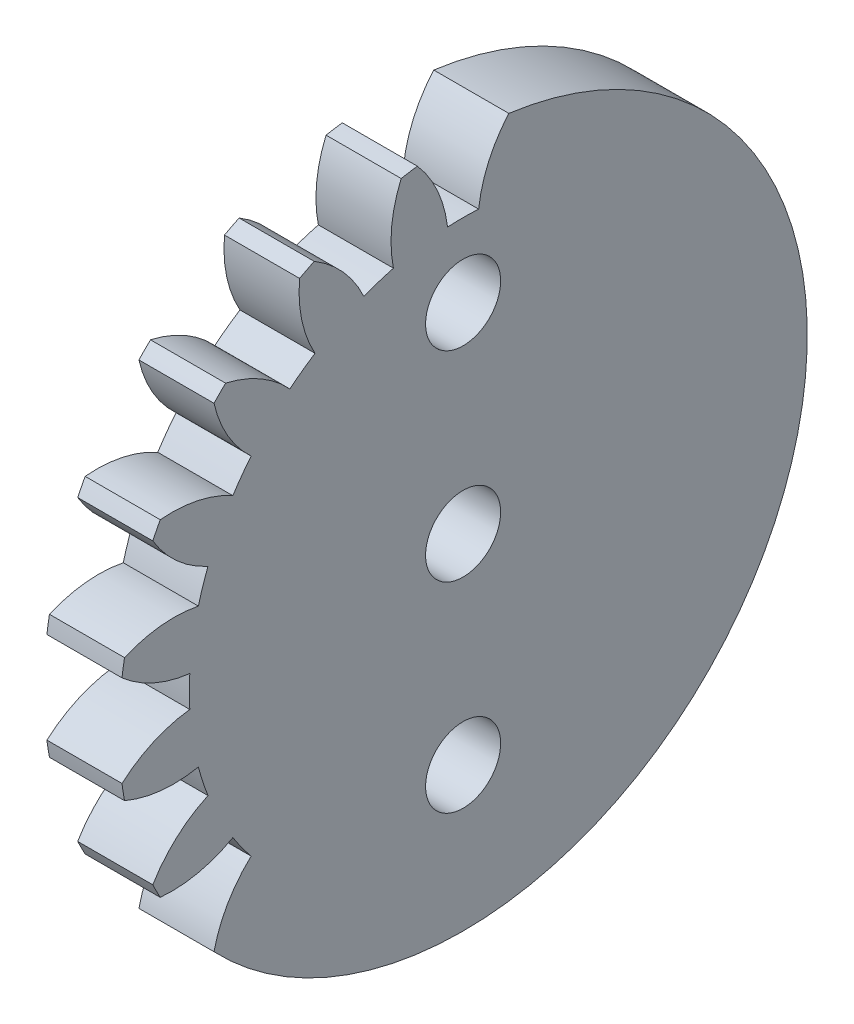
from build123d import *

# Parameters (mm, degrees)
BASPROSKE_W         = 3
BASPROSKE_H         = 13.75
TOOTHCUT_DEPTH      = 20.67549237
TEETHCUTS_COUNT     = 8
TEETHCUTS_ANGLE     = 126
BORSKE_R            = 1.5
BORE_DEPTH          = 50.0000508
SKETCH_2_R          = 1.5
CUT_EXTRUDE_2_DEPTH = 7


with BuildPart() as part:
    # BasProSke → Base-Revolve (revolve)
    with BuildSketch(Plane(origin=(0, 0, 0), x_dir=(1, 0, 0), z_dir=(0, 1, 0))):
        with Locations((1.5, 6.875)):
            Rectangle(BASPROSKE_W, BASPROSKE_H)
    revolve(axis=Axis((-10, 0, 0), (1, 0, 0)))

    # TooCutSke → ToothCut (cut, through all)
    with BuildSketch(Plane(origin=(0, 0, 0), x_dir=(0, 0, -1), z_dir=(1, 0, 0))):
        with BuildLine():
            ThreePointArc((0.62110296, 10.918848994), (0, 10.9365), (-0.62110296, 10.918848994))
            ThreePointArc((-0.62110296, 10.918848994), (-1.024517052, 12.378857135), (-1.846615859, 13.651067908))
            ThreePointArc((-1.846615859, 13.651067908), (0, 13.7754), (1.846615859, 13.651067908))
            ThreePointArc((1.846615859, 13.651067908), (1.024517052, 12.378857135), (0.62110296, 10.918848994))
        make_face()
    toothcut = extrude(amount=TOOTHCUT_DEPTH, mode=Mode.SUBTRACT)

    # TeethCuts: ToothCut ×8 about axis
    teethcuts_axis = Axis((-10, 0, 0), (1, 0, 0))
    for i in range(1, TEETHCUTS_COUNT):
        add(toothcut.rotate(teethcuts_axis, i * TEETHCUTS_ANGLE / (TEETHCUTS_COUNT - 1)), mode=Mode.SUBTRACT)

    # BorSke → Bore (cut, symmetric)
    with BuildSketch(Plane(origin=(0, 0, 0), x_dir=(0, 0, -1), z_dir=(1, 0, 0))):
        Circle(BORSKE_R)
    extrude(amount=BORE_DEPTH, both=True, mode=Mode.SUBTRACT)

    # 草圖2 → 除料-伸長2 (cut)
    with BuildSketch(Plane.ZY):
        with Locations((0, -8)):
            Circle(SKETCH_2_R)
        with Locations((0, 8)):
            Circle(SKETCH_2_R)
    extrude(amount=-CUT_EXTRUDE_2_DEPTH, mode=Mode.SUBTRACT)


solid = part.part
